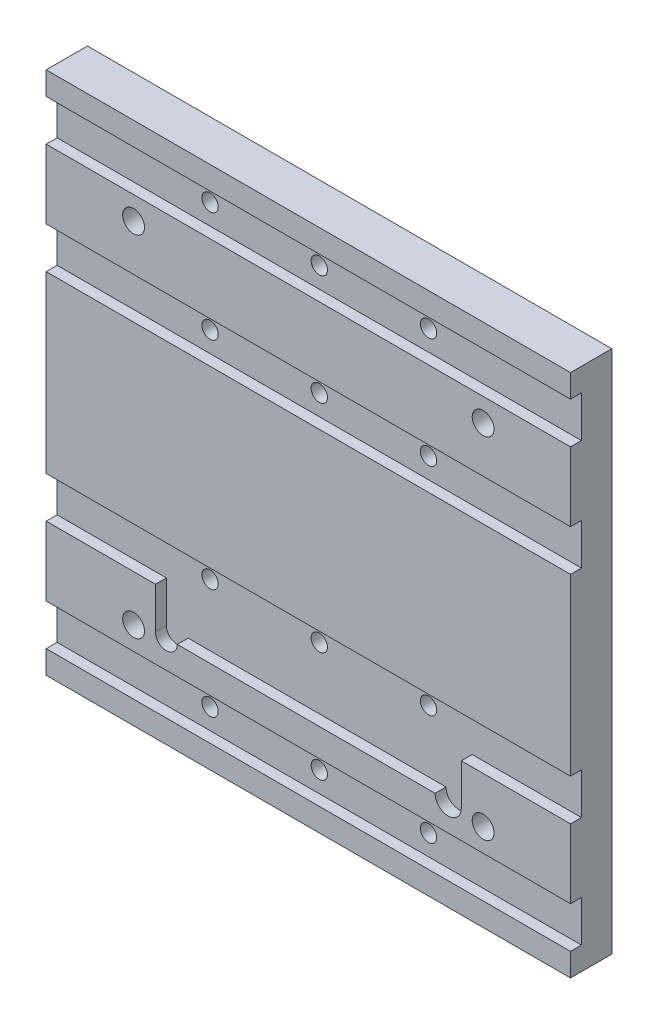
from build123d import *

# Parameters (mm, degrees)
SKETCH1_W           = 152.4
SKETCH1_H           = 152.4
SKETCH1_R           = 3.175
BOSS_EXTRUDE1_DEPTH = 12
SKETCH2_R           = 2.38125
SKETCH2_W           = 152.4
SKETCH2_H           = 12
CUT_EXTRUDE1_DEPTH  = 3.175
SKETCH3_R           = 2.38125
CUT_EXTRUDE2_DEPTH  = 109.429147373
SKETCH5_R           = 3.96875
CUT_EXTRUDE7_DEPTH  = 5.08


with BuildPart() as part:
    # Sketch1 → Boss-Extrude1 (new body)
    with BuildSketch(Plane.XY):
        Rectangle(SKETCH1_W, SKETCH1_H)
        with Locations((-50.8, 50.8)):
            Circle(SKETCH1_R, mode=Mode.SUBTRACT)
        with Locations((-50.8, -50.8)):
            Circle(SKETCH1_R, mode=Mode.SUBTRACT)
        with Locations((50.8, 50.8)):
            Circle(SKETCH1_R, mode=Mode.SUBTRACT)
        with Locations((50.8, -50.8)):
            Circle(SKETCH1_R, mode=Mode.SUBTRACT)
    extrude(amount=BOSS_EXTRUDE1_DEPTH)

    # Sketch2 → Cut-Extrude1 (cut)
    # profile 1 of 4: a face of its own
    with BuildSketch(Plane.XY.offset(12)):
        with BuildLine():
            Line((-76.2, -25.4), (76.2, -25.4))
            Line((76.2, -25.4), (76.2, -37.4))
            Line((76.2, -37.4), (44.45, -37.4))
            Line((44.45, -37.4), (44.45, -49.3888))
            ThreePointArc((44.45, -49.3888), (40.64, -53.1988), (36.83, -49.3888))
            Line((36.83, -49.3888), (-38.1, -49.3888))
            ThreePointArc((-38.1, -49.3888), (-41.275, -52.5638), (-44.45, -49.3888))
            Line((-44.45, -49.3888), (-44.45, -37.4))
            Line((-44.45, -37.4), (-76.2, -37.4))
            Line((-76.2, -37.4), (-76.2, -25.4))
        make_face()
        with Locations((0, -31.4)):
            Circle(SKETCH2_R, mode=Mode.SUBTRACT)
        with Locations((-31.75, -31.4)):
            Circle(SKETCH2_R, mode=Mode.SUBTRACT)
        with Locations((31.75, -31.4)):
            Circle(SKETCH2_R, mode=Mode.SUBTRACT)
    # profile 2 of 4: a face of its own
    with BuildSketch(Plane.XY.offset(12)):
        with Locations((0, 31.4)):
            Rectangle(SKETCH2_W, SKETCH2_H)
        with Locations((0, 31.4)):
            Circle(SKETCH2_R, mode=Mode.SUBTRACT)
        with Locations((31.75, 31.4)):
            Circle(SKETCH2_R, mode=Mode.SUBTRACT)
        with Locations((-31.75, 31.4)):
            Circle(SKETCH2_R, mode=Mode.SUBTRACT)
    # profile 3 of 4: a face of its own
    with BuildSketch(Plane.XY.offset(12)):
        with Locations((0, 63.5)):
            Rectangle(SKETCH2_W, SKETCH2_H)
        with Locations((-31.75, 63.5)):
            Circle(SKETCH2_R, mode=Mode.SUBTRACT)
        with Locations((0, 63.5)):
            Circle(SKETCH2_R, mode=Mode.SUBTRACT)
        with Locations((31.75, 63.5)):
            Circle(SKETCH2_R, mode=Mode.SUBTRACT)
    # profile 4 of 4: a face of its own
    with BuildSketch(Plane.XY.offset(12)):
        with Locations((0, -63.5)):
            Rectangle(SKETCH2_W, SKETCH2_H)
        with Locations((0, -63.5)):
            Circle(SKETCH2_R, mode=Mode.SUBTRACT)
        with Locations((-31.75, -63.5)):
            Circle(SKETCH2_R, mode=Mode.SUBTRACT)
        with Locations((31.75, -63.5)):
            Circle(SKETCH2_R, mode=Mode.SUBTRACT)
    extrude(amount=-CUT_EXTRUDE1_DEPTH, mode=Mode.SUBTRACT)

    # Sketch3 → Cut-Extrude2 (cut, through all)
    with BuildSketch(Plane.XY.offset(12)):
        with Locations((-31.75, 63.5)):
            Circle(SKETCH3_R)
        with Locations((0, 63.5)):
            Circle(SKETCH3_R)
        with Locations((31.75, 63.5)):
            Circle(SKETCH3_R)
        with Locations((-31.75, 31.4)):
            Circle(SKETCH3_R)
        with Locations((0, 31.4)):
            Circle(SKETCH3_R)
        with Locations((31.75, 31.4)):
            Circle(SKETCH3_R)
        with Locations((-31.75, -31.4)):
            Circle(SKETCH3_R)
        with Locations((0, -31.4)):
            Circle(SKETCH3_R)
        with Locations((31.75, -31.4)):
            Circle(SKETCH3_R)
        with Locations((-31.75, -63.5)):
            Circle(SKETCH3_R)
        with Locations((0, -63.5)):
            Circle(SKETCH3_R)
        with Locations((31.75, -63.5)):
            Circle(SKETCH3_R)
    extrude(amount=-CUT_EXTRUDE2_DEPTH, mode=Mode.SUBTRACT)

    # Sketch5 → Cut-Extrude7 (cut)
    with BuildSketch(Plane(origin=(0, 0, 0), x_dir=(-1, 0, 0), z_dir=(0, 0, -1))):
        with Locations((31.75, -63.5)):
            Circle(SKETCH5_R)
        with Locations((0, -63.5)):
            Circle(SKETCH5_R)
        with Locations((-31.75, -63.5)):
            Circle(SKETCH5_R)
        with Locations((-31.75, -31.4)):
            Circle(SKETCH5_R)
        with Locations((0, -31.4)):
            Circle(SKETCH5_R)
        with Locations((31.75, -31.4)):
            Circle(SKETCH5_R)
        with Locations((31.75, 31.4)):
            Circle(SKETCH5_R)
        with Locations((0, 31.4)):
            Circle(SKETCH5_R)
        with Locations((-31.75, 31.4)):
            Circle(SKETCH5_R)
        with Locations((-31.75, 63.5)):
            Circle(SKETCH5_R)
        with Locations((0, 63.5)):
            Circle(SKETCH5_R)
        with Locations((31.75, 63.5)):
            Circle(SKETCH5_R)
    extrude(amount=-CUT_EXTRUDE7_DEPTH, mode=Mode.SUBTRACT)


solid = part.part
